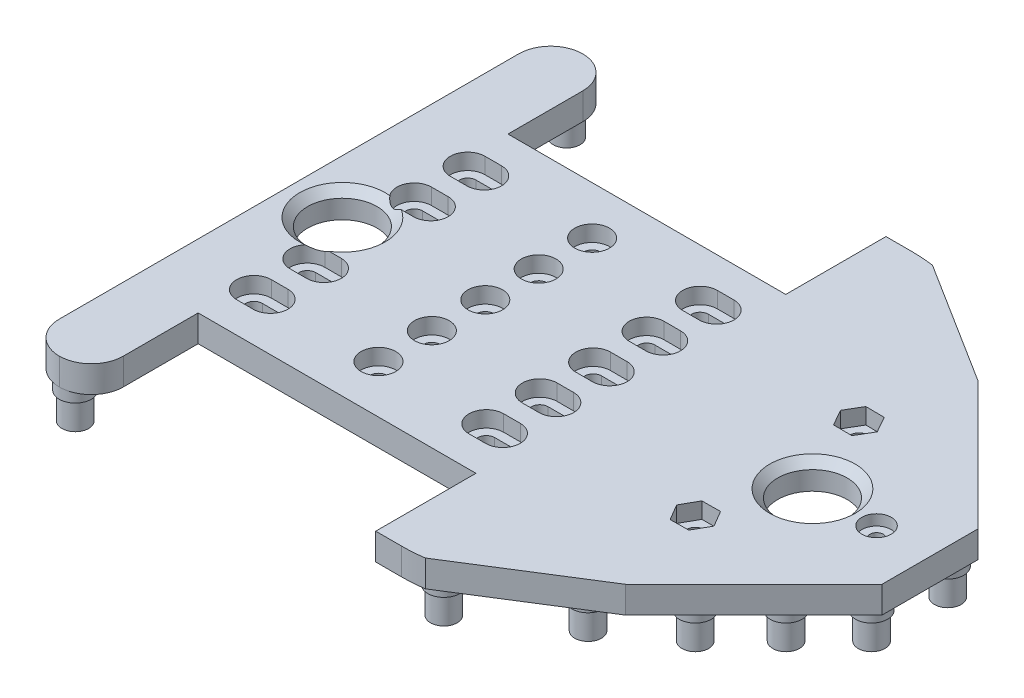
from build123d import *

# Parameters (mm, degrees)
SKETCH1_R           = 6.5
SKETCH1_R_2         = 1.55
SKETCH1_R_3         = 1.25
BOSS_EXTRUDE1_DEPTH = 5
FILLET1_R           = 30
FILLET2_R           = 6
SKETCH3_R           = 3.25
CUT_EXTRUDE2_DEPTH  = 3
SKETCH4_R           = 3
BOSS_EXTRUDE2_DEPTH = 2
SKETCH5_R           = 2.5
BOSS_EXTRUDE3_DEPTH = 5
CUT_EXTRUDE3_DEPTH  = 100.047038199
SKETCH7_R           = 2.75
CUT_EXTRUDE4_DEPTH  = 2
CHAMFER1_SIZE       = 1.5


# Some blends are built 0.0001 mm under size
with BuildPart() as part:
    # Sketch1 → Boss-Extrude1 (new body)
    with BuildSketch(Plane(origin=(0, 0, 0), x_dir=(1, 0, 0), z_dir=(0, 1, 0))):
        Polygon((70.213351221, 28.810680715), (31.441947759, 67.582084177), (14.213351221, 67.582084177), (14.213351221, 48.821516158), (-37.786648779, 48.821516158), (-37.786648779, 68.821516158), (-49.786648779, 68.821516158), (-49.786648779, -29.178483842), (-37.786648779, -29.178483842), (-37.786648779, -9.178483842), (14.213351221, -9.178483842), (14.213351221, -27.93905186), (31.441947759, -27.93905186), (70.213351221, 10.832351601), align=None)
        with Locations(Location((48.213351221, 19.821516158, 0), (0, 0, 270))):
            Circle(SKETCH1_R, mode=Mode.SUBTRACT)
        with Locations(Location((-13.036648779, -0.178483842, 0), (0, 0, 270))):
            Circle(SKETCH1_R_2, mode=Mode.SUBTRACT)
        with Locations(Location((-13.036648779, 9.821516158, 0), (0, 0, 270))):
            Circle(SKETCH1_R_2, mode=Mode.SUBTRACT)
        with Locations(Location((-13.036648779, 19.821516158, 0), (0, 0, 270))):
            Circle(SKETCH1_R_2, mode=Mode.SUBTRACT)
        with Locations(Location((-13.036648779, 29.821516158, 0), (0, 0, 270))):
            Circle(SKETCH1_R_2, mode=Mode.SUBTRACT)
        with Locations(Location((-13.036648779, 39.821516158, 0), (0, 0, 270))):
            Circle(SKETCH1_R_2, mode=Mode.SUBTRACT)
        with Locations(Location((41.595278865, 35.128388238, 0), (0, 0, 270))):
            Circle(SKETCH1_R_2, mode=Mode.SUBTRACT)
        with Locations(Location((41.595278865, 4.514644078, 0), (0, 0, 270))):
            Circle(SKETCH1_R_2, mode=Mode.SUBTRACT)
        with Locations(Location((-39.786648779, 19.821516158, 0), (0, 0, 270))):
            Circle(SKETCH1_R, mode=Mode.SUBTRACT)
        with Locations(Location((60.213351221, 19.821516158, 0), (0, 0, 270))):
            Circle(SKETCH1_R_3, mode=Mode.SUBTRACT)
        with BuildLine():
            Line((-36.336648779, 41.371516158), (-33.236648779, 41.371516158))
            ThreePointArc((-33.236648779, 41.371516158), (-31.686648779, 39.821516158), (-33.236648779, 38.271516158))
            Line((-33.236648779, 38.271516158), (-36.336648779, 38.271516158))
            ThreePointArc((-36.336648779, 38.271516158), (-37.886648779, 39.821516158), (-36.336648779, 41.371516158))
        make_face(mode=Mode.SUBTRACT)
        with BuildLine():
            Line((7.163351221, 41.371516158), (10.263351221, 41.371516158))
            ThreePointArc((10.263351221, 41.371516158), (11.813351221, 39.821516158), (10.263351221, 38.271516158))
            Line((10.263351221, 38.271516158), (7.163351221, 38.271516158))
            ThreePointArc((7.163351221, 38.271516158), (5.613351221, 39.821516158), (7.163351221, 41.371516158))
        make_face(mode=Mode.SUBTRACT)
        with BuildLine():
            Line((7.163351221, 31.371516158), (10.263351221, 31.371516158))
            ThreePointArc((10.263351221, 31.371516158), (11.813351221, 29.821516158), (10.263351221, 28.271516158))
            Line((10.263351221, 28.271516158), (7.163351221, 28.271516158))
            ThreePointArc((7.163351221, 28.271516158), (5.613351221, 29.821516158), (7.163351221, 31.371516158))
        make_face(mode=Mode.SUBTRACT)
        with BuildLine():
            Line((7.163351221, 21.371516158), (10.263351221, 21.371516158))
            ThreePointArc((10.263351221, 21.371516158), (11.813351221, 19.821516158), (10.263351221, 18.271516158))
            Line((10.263351221, 18.271516158), (7.163351221, 18.271516158))
            ThreePointArc((7.163351221, 18.271516158), (5.613351221, 19.821516158), (7.163351221, 21.371516158))
        make_face(mode=Mode.SUBTRACT)
        with BuildLine():
            Line((7.163351221, 11.371516158), (10.263351221, 11.371516158))
            ThreePointArc((10.263351221, 11.371516158), (11.813351221, 9.821516158), (10.263351221, 8.271516158))
            Line((10.263351221, 8.271516158), (7.163351221, 8.271516158))
            ThreePointArc((7.163351221, 8.271516158), (5.613351221, 9.821516158), (7.163351221, 11.371516158))
        make_face(mode=Mode.SUBTRACT)
        with BuildLine():
            Line((7.163351221, 1.371516158), (10.263351221, 1.371516158))
            ThreePointArc((10.263351221, 1.371516158), (11.813351221, -0.178483842), (10.263351221, -1.728483842))
            Line((10.263351221, -1.728483842), (7.163351221, -1.728483842))
            ThreePointArc((7.163351221, -1.728483842), (5.613351221, -0.178483842), (7.163351221, 1.371516158))
        make_face(mode=Mode.SUBTRACT)
        with BuildLine():
            Line((-36.336648779, 31.371516158), (-33.236648779, 31.371516158))
            ThreePointArc((-33.236648779, 31.371516158), (-31.686648779, 29.821516158), (-33.236648779, 28.271516158))
            Line((-33.236648779, 28.271516158), (-36.336648779, 28.271516158))
            ThreePointArc((-36.336648779, 28.271516158), (-37.886648779, 29.821516158), (-36.336648779, 31.371516158))
        make_face(mode=Mode.SUBTRACT)
        with BuildLine():
            Line((-36.336648779, 11.371516158), (-33.236648779, 11.371516158))
            ThreePointArc((-33.236648779, 11.371516158), (-31.686648779, 9.821516158), (-33.236648779, 8.271516158))
            Line((-33.236648779, 8.271516158), (-36.336648779, 8.271516158))
            ThreePointArc((-36.336648779, 8.271516158), (-37.886648779, 9.821516158), (-36.336648779, 11.371516158))
        make_face(mode=Mode.SUBTRACT)
        with BuildLine():
            Line((-36.336648779, 1.371516158), (-33.236648779, 1.371516158))
            ThreePointArc((-33.236648779, 1.371516158), (-31.686648779, -0.178483842), (-33.236648779, -1.728483842))
            Line((-33.236648779, -1.728483842), (-36.336648779, -1.728483842))
            ThreePointArc((-36.336648779, -1.728483842), (-37.886648779, -0.178483842), (-36.336648779, 1.371516158))
        make_face(mode=Mode.SUBTRACT)
    extrude(amount=BOSS_EXTRUDE1_DEPTH)

    # Fillet1
    fillet1_edges = [part.edges().sort_by_distance(p)[0] for p in [
        (31.441947759, 2.5, 27.93905186),
        (31.441947759, 2.5, -67.582084177),
    ]]
    fillet(fillet1_edges, radius=FILLET1_R)

    # Fillet2
    fillet2_edges = [part.edges().sort_by_distance(p)[0] for p in [
        (-37.786648779, 2.5, 29.178483842),
        (-49.786648779, 2.5, 29.178483842),
        (-37.786648779, 2.5, -68.821516158),
        (-49.786648779, 2.5, -68.821516158),
    ]]
    fillet(fillet2_edges, radius=FILLET2_R - 0.0001)  # a hair under: the kernel refuses the full size

    # Sketch3 → Cut-Extrude2 (cut)
    with BuildSketch(Plane(origin=(0, 5, 0), x_dir=(1, 0, 0), z_dir=(0, 1, 0))):
        with Locations(Location((-13.036648779, 39.821516158, 0), (0, 0, 270))):
            Circle(SKETCH3_R)
        with Locations(Location((-13.036648779, 29.821516158, 0), (0, 0, 270))):
            Circle(SKETCH3_R)
        with Locations(Location((-13.036648779, 19.821516158, 0), (0, 0, 270))):
            Circle(SKETCH3_R)
        with Locations(Location((-13.036648779, 9.821516158, 0), (0, 0, 270))):
            Circle(SKETCH3_R)
        with Locations(Location((-13.036648779, -0.178483842, 0), (0, 0, 270))):
            Circle(SKETCH3_R)
        with BuildLine():
            Line((-33.236648779, 36.571516158), (-36.336648779, 36.571516158))
            ThreePointArc((-36.336648779, 36.571516158), (-39.586648779, 39.821516158), (-36.336648779, 43.071516158))
            Line((-36.336648779, 43.071516158), (-33.236648779, 43.071516158))
            ThreePointArc((-33.236648779, 43.071516158), (-29.986648779, 39.821516158), (-33.236648779, 36.571516158))
        make_face()
        with BuildLine():
            Line((10.263351221, 36.571516158), (7.163351221, 36.571516158))
            ThreePointArc((7.163351221, 36.571516158), (3.913351221, 39.821516158), (7.163351221, 43.071516158))
            Line((7.163351221, 43.071516158), (10.263351221, 43.071516158))
            ThreePointArc((10.263351221, 43.071516158), (13.513351221, 39.821516158), (10.263351221, 36.571516158))
        make_face()
        with BuildLine():
            Line((10.263351221, 26.571516158), (7.163351221, 26.571516158))
            ThreePointArc((7.163351221, 26.571516158), (3.913351221, 29.821516158), (7.163351221, 33.071516158))
            Line((7.163351221, 33.071516158), (10.263351221, 33.071516158))
            ThreePointArc((10.263351221, 33.071516158), (13.513351221, 29.821516158), (10.263351221, 26.571516158))
        make_face()
        with BuildLine():
            Line((10.263351221, 16.571516158), (7.163351221, 16.571516158))
            ThreePointArc((7.163351221, 16.571516158), (3.913351221, 19.821516158), (7.163351221, 23.071516158))
            Line((7.163351221, 23.071516158), (10.263351221, 23.071516158))
            ThreePointArc((10.263351221, 23.071516158), (13.513351221, 19.821516158), (10.263351221, 16.571516158))
        make_face()
        with BuildLine():
            Line((10.263351221, 6.571516158), (7.163351221, 6.571516158))
            ThreePointArc((7.163351221, 6.571516158), (3.913351221, 9.821516158), (7.163351221, 13.071516158))
            Line((7.163351221, 13.071516158), (10.263351221, 13.071516158))
            ThreePointArc((10.263351221, 13.071516158), (13.513351221, 9.821516158), (10.263351221, 6.571516158))
        make_face()
        with BuildLine():
            Line((10.263351221, -3.428483842), (7.163351221, -3.428483842))
            ThreePointArc((7.163351221, -3.428483842), (3.913351221, -0.178483842), (7.163351221, 3.071516158))
            Line((7.163351221, 3.071516158), (10.263351221, 3.071516158))
            ThreePointArc((10.263351221, 3.071516158), (13.513351221, -0.178483842), (10.263351221, -3.428483842))
        make_face()
        with BuildLine():
            Line((-33.236648779, 26.571516158), (-36.336648779, 26.571516158))
            ThreePointArc((-36.336648779, 26.571516158), (-39.586648779, 29.821516158), (-36.336648779, 33.071516158))
            Line((-36.336648779, 33.071516158), (-33.236648779, 33.071516158))
            ThreePointArc((-33.236648779, 33.071516158), (-29.986648779, 29.821516158), (-33.236648779, 26.571516158))
        make_face()
        with BuildLine():
            Line((-33.236648779, 6.571516158), (-36.336648779, 6.571516158))
            ThreePointArc((-36.336648779, 6.571516158), (-39.586648779, 9.821516158), (-36.336648779, 13.071516158))
            Line((-36.336648779, 13.071516158), (-33.236648779, 13.071516158))
            ThreePointArc((-33.236648779, 13.071516158), (-29.986648779, 9.821516158), (-33.236648779, 6.571516158))
        make_face()
        with BuildLine():
            Line((-33.236648779, -3.428483842), (-36.336648779, -3.428483842))
            ThreePointArc((-36.336648779, -3.428483842), (-39.586648779, -0.178483842), (-36.336648779, 3.071516158))
            Line((-36.336648779, 3.071516158), (-33.236648779, 3.071516158))
            ThreePointArc((-33.236648779, 3.071516158), (-29.986648779, -0.178483842), (-33.236648779, -3.428483842))
        make_face()
        Polygon((43.355108262, 38.112177857), (39.891155954, 38.144340012), (38.131326556, 35.160550393), (39.835449468, 32.144598619), (43.299401776, 32.112436464), (45.059231174, 35.096226083), align=None)
        Polygon((45.059231174, 4.546806233), (43.355108262, 1.530854459), (39.891155954, 1.498692304), (38.131326556, 4.482481924), (39.835449468, 7.498433698), (43.299401776, 7.530595853), align=None)
    extrude(amount=-CUT_EXTRUDE2_DEPTH, mode=Mode.SUBTRACT)

    # Sketch4 → Boss-Extrude2 (add)
    with BuildSketch(Plane(origin=(0, 0, 0), x_dir=(-1, 0, 0), z_dir=(0, -1, 0))):
        with Locations(Location((-22.213351221, -23.178483842, 0), (0, 0, 270))):
            Circle(SKETCH4_R)
        with Locations(Location((-38.213351221, -12.178483842, 0), (0, 0, 270))):
            Circle(SKETCH4_R)
        with Locations(Location((43.786648779, -26.178483842, 0), (0, 0, 269.99934797))):
            Circle(SKETCH4_R)
        with Locations(Location((43.786648779, 65.821516158, 0), (0, 0, 270))):
            Circle(SKETCH4_R)
        with Locations(Location((-58.413351221, 4.689205851, 0), (0, 0, 270))):
            Circle(SKETCH4_R)
        with Locations(Location((-49.913351221, -3.810794149, 0), (0, 0, 270))):
            Circle(SKETCH4_R)
        with Locations(Location((-66.413351221, 12.689205851, 0), (0, 0, 270))):
            Circle(SKETCH4_R)
        with Locations(Location((-66.413351221, 26.953826466, 0), (0, 0, 270))):
            Circle(SKETCH4_R)
        with Locations(Location((-49.913351221, 43.453826466, 0), (0, 0, 270))):
            Circle(SKETCH4_R)
        with Locations(Location((-58.413351221, 34.953826466, 0), (0, 0, 270))):
            Circle(SKETCH4_R)
        with Locations(Location((-38.213351221, 51.821516158, 0), (0, 0, 270))):
            Circle(SKETCH4_R)
        with Locations(Location((-22.213351221, 62.821516158, 0), (0, 0, 270))):
            Circle(SKETCH4_R)
    extrude(amount=BOSS_EXTRUDE2_DEPTH)

    # Sketch5 → Boss-Extrude3 (add)
    with BuildSketch(Plane(origin=(0, -2, 0), x_dir=(-1, 0, 0), z_dir=(0, -1, 0))):
        with Locations(Location((-22.213351221, -23.178483842, 0), (0, 0, 90))):
            Circle(SKETCH5_R)
        with Locations(Location((43.786648779, -26.178483842, 0), (0, 0, 90))):
            Circle(SKETCH5_R)
        with Locations(Location((-38.213351221, -12.178483842, 0), (0, 0, 90))):
            Circle(SKETCH5_R)
        with Locations(Location((-49.913351221, -3.810794149, 0), (0, 0, 90))):
            Circle(SKETCH5_R)
        with Locations(Location((-58.413351221, 4.689205851, 0), (0, 0, 90))):
            Circle(SKETCH5_R)
        with Locations(Location((-66.413351221, 12.689205851, 0), (0, 0, 90))):
            Circle(SKETCH5_R)
        with Locations(Location((-66.413351221, 26.953826466, 0), (0, 0, 270))):
            Circle(SKETCH5_R)
        with Locations(Location((-58.413351221, 34.953826466, 0), (0, 0, 270))):
            Circle(SKETCH5_R)
        with Locations(Location((-49.913351221, 43.453826466, 0), (0, 0, 270))):
            Circle(SKETCH5_R)
        with Locations(Location((-38.213351221, 51.821516158, 0), (0, 0, 270))):
            Circle(SKETCH5_R)
        with Locations(Location((43.786648779, 65.821516158, 0), (0, 0, 270))):
            Circle(SKETCH5_R)
        with Locations(Location((-22.213351221, 62.821516158, 0), (0, 0, 270))):
            Circle(SKETCH5_R)
    extrude(amount=BOSS_EXTRUDE3_DEPTH)

    # Sketch6 → Cut-Extrude3 (cut, through all)
    with BuildSketch(Plane(origin=(0, 5, 0), x_dir=(1, 0, 0), z_dir=(0, 1, 0))):
        Polygon((23.213351221, -27.643906487), (46.213351221, -13.167648399), (46.213351221, -27.643906487), align=None)
        Polygon((46.213351221, 67.286938804), (46.213351221, 52.810680715), (23.213351221, 67.286938804), align=None)
    extrude(amount=-CUT_EXTRUDE3_DEPTH, mode=Mode.SUBTRACT)

    # Sketch7 → Cut-Extrude4 (cut)
    with BuildSketch(Plane(origin=(0, 5, 0), x_dir=(1, 0, 0), z_dir=(0, 1, 0))):
        with Locations(Location((60.213351221, 19.821516158, 0), (0, 0, 270))):
            Circle(SKETCH7_R)
    extrude(amount=-CUT_EXTRUDE4_DEPTH, mode=Mode.SUBTRACT)

    # Chamfer1
    # the kernel refuses this chamfer: 1.5 mm, written as the material it takes off along each edge
    with BuildSketch(Plane(origin=(48.213351221, 5, -19.821516158), x_dir=(0, 0, 1), z_dir=(-1, 0, 0))) as chamfer1_piece_1:
        Polygon((6.5, -CHAMFER1_SIZE), (6.5 + CHAMFER1_SIZE, 0), (6.5, 0), align=None)
    revolve(axis=Axis((48.213351221, 5, -19.821516158), (0, 1, 0)), mode=Mode.SUBTRACT)
    with BuildSketch(Plane(origin=(-39.786648779, 5, -19.821516158), x_dir=(0, 0, 1), z_dir=(-1, 0, 0))) as chamfer1_piece_2:
        Polygon((6.5, -CHAMFER1_SIZE), (6.5 + CHAMFER1_SIZE, 0), (6.5, 0), align=None)
    revolve(axis=Axis((-39.786648779, 5, -19.821516158), (0, 1, 0)), mode=Mode.SUBTRACT)


solid = part.part
